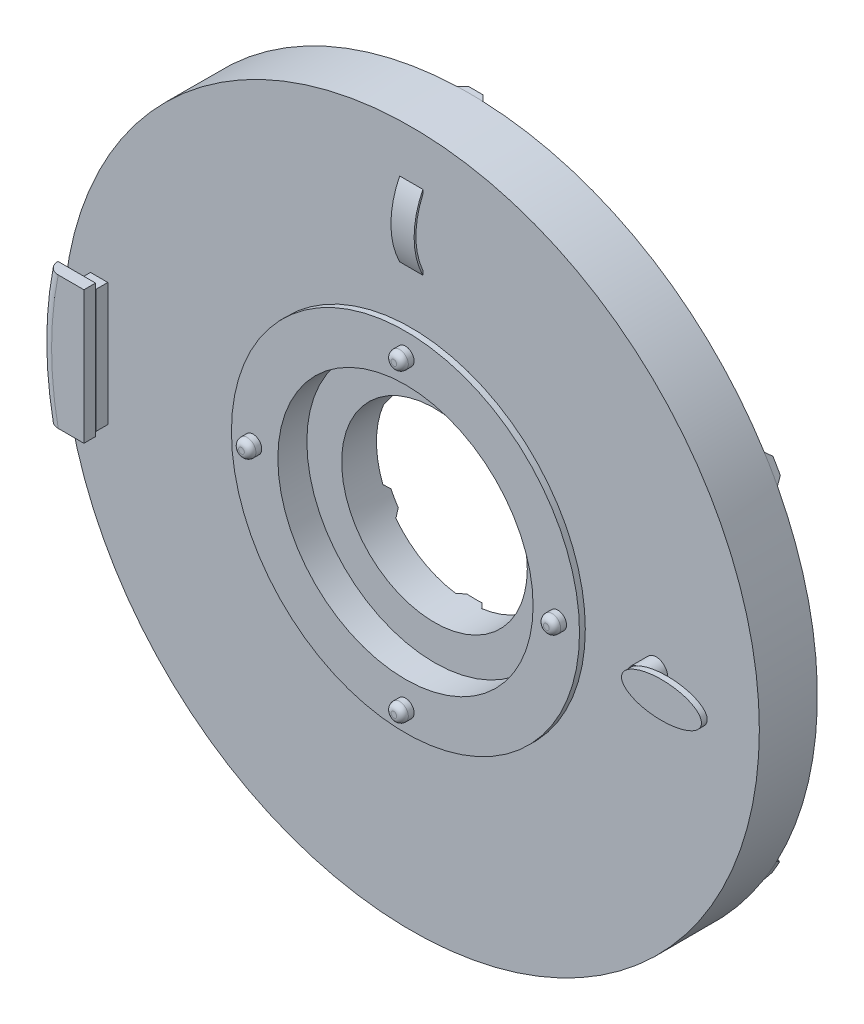
from build123d import *

# Parameters (mm, degrees)
SKETCH1_R                    = 600
BOSS_EXTRUDE1_DEPTH          = 100
SKETCH2_R                    = 300
BOSS_EXTRUDE2_DEPTH          = 10
SKETCH3_R                    = 220
CUT_EXTRUDE1_DEPTH           = 50
SKETCH4_R                    = 160
CUT_EXTRUDE2_DEPTH           = 851.646812725
SKETCH6_R                    = 14.913025091
BOSS_EXTRUDE4_DEPTH          = 20
FILLET1_R                    = 10
SKETCH7_W                    = 29.826050183
SKETCH7_H                    = 212.223818606
BOSS_EXTRUDE5_DEPTH          = 20
BOSS_EXTRUDE6_DEPTH          = 20
FILLET2_R                    = 20
SKETCH10_R                   = 19.778043507
BOSS_EXTRUDE7_DEPTH          = 30
SKETCH11_RX                  = 68.900732716
SKETCH11_RY                  = 30.614806754
BOSS_EXTRUDE9_DEPTH          = 10
BOSS_EXTRUDE10_DEPTH         = 20
BOSS_EXTRUDE11_DEPTH         = 10
CHAMFER1_SIZE                = 9.0254
CIRPATTERN1_COUNT            = 6
CHAMFER1_OF_CIRPATTERN1_SIZE = 9.0254
SKETCH14_R                   = 17.44469043
BOSS_EXTRUDE12_DEPTH         = 10
FILLET3_R                    = 8


with BuildPart() as part:
    # Sketch1 → Boss-Extrude1 (new body)
    with BuildSketch(Plane.XY):
        Circle(SKETCH1_R)
    extrude(amount=BOSS_EXTRUDE1_DEPTH)

    # Sketch2 → Boss-Extrude2 (add)
    with BuildSketch(Plane.XY.offset(100)):
        Circle(SKETCH2_R)
    extrude(amount=BOSS_EXTRUDE2_DEPTH)

    # Sketch3 → Cut-Extrude1 (cut)
    with BuildSketch(Plane.XY.offset(110)):
        Circle(SKETCH3_R)
    extrude(amount=-CUT_EXTRUDE1_DEPTH, mode=Mode.SUBTRACT)

    # Sketch4 → Cut-Extrude2 (cut, through all)
    with BuildSketch(Plane.XY.offset(60)):
        Circle(SKETCH4_R)
    extrude(amount=-CUT_EXTRUDE2_DEPTH, mode=Mode.SUBTRACT)

    # Sketch6 → Boss-Extrude4 (add)
    with BuildSketch(Plane.XY.offset(110)):
        with Locations((-262.698672761, 0)):
            Circle(SKETCH6_R)
        with Locations((0, 262.698672761)):
            Circle(SKETCH6_R)
        with Locations((262.698672761, 0)):
            Circle(SKETCH6_R)
        with Locations((0, -262.698672761)):
            Circle(SKETCH6_R)
    extrude(amount=BOSS_EXTRUDE4_DEPTH)

    # Fillet1
    fillet1_edges = [part.edges().sort_by_distance(p)[0] for p in [
        (-277.611697852, 0, 130),
        (-14.913025091, 262.698672761, 130),
        (247.78564767, 0, 130),
        (-14.913025091, -262.698672761, 130),
    ]]
    fillet(fillet1_edges, radius=FILLET1_R)

    # Sketch7 → Boss-Extrude5 (add)
    with BuildSketch(Plane.XY.offset(100)):
        with Locations((-538.016059061, 0)):
            Rectangle(SKETCH7_W, SKETCH7_H)
    extrude(amount=BOSS_EXTRUDE5_DEPTH)

    # Sketch9 → Boss-Extrude6 (add)
    with BuildSketch(Plane.XY.offset(120)):
        with BuildLine():
            Line((-588.949449766, 114.623495062), (-524.250189746, 114.623495062))
            Line((-524.250189746, 114.623495062), (-524.250189746, -114.623495062))
            Line((-524.250189746, -114.623495062), (-588.949449766, -114.623495062))
            ThreePointArc((-588.949449766, -114.623495062), (-600, 0), (-588.949449766, 114.623495062))
        make_face()
    extrude(amount=BOSS_EXTRUDE6_DEPTH)

    # Fillet2
    fillet2_edges = [part.edges().sort_by_distance(p)[0] for p in [
        (-600, 0, 140),
    ]]
    fillet(fillet2_edges, radius=FILLET2_R - 0.0001)  # a hair under: the kernel refuses the full size

    # Sketch10 → Boss-Extrude7 (add)
    with BuildSketch(Plane.XY.offset(100)):
        with Locations((422.153325659, 0)):
            Circle(SKETCH10_R)
    extrude(amount=BOSS_EXTRUDE7_DEPTH)

    # Sketch11 → Boss-Extrude9 (add)
    with BuildSketch(Plane.XY.offset(130)):
        with Locations(Location((471.276014868, 0), (0, 0, 180))):
            Ellipse(SKETCH11_RX, SKETCH11_RY)
    extrude(amount=BOSS_EXTRUDE9_DEPTH)

    # Sketch12 → Boss-Extrude10 (add)
    with BuildSketch(Plane(origin=(0, 0, 0), x_dir=(0, 0, -1), z_dir=(1, 0, 0))):
        with BuildLine():
            Line((-100, 509.437716403), (-100, 516.609901971))
            ThreePointArc((-100, 516.609901971), (-115.08720969, 452.50849346), (-100, 388.407084949))
            Line((-100, 388.407084949), (-100, 395.579270517))
            ThreePointArc((-100, 395.579270517), (-112.034809058, 452.50849346), (-100, 509.437716403))
        make_face()
    boss_extrude10 = extrude(amount=BOSS_EXTRUDE10_DEPTH)

    # Mirror1: Boss-Extrude10 across plane
    add(boss_extrude10.mirror(Plane(origin=(0, 0, 0), x_dir=(0, 0, 1), z_dir=(1, 0, 0))))

    # Sketch13 → Boss-Extrude11 (add)
    with BuildSketch(Plane(origin=(0, 0, 0), x_dir=(-1, 0, 0), z_dir=(0, 0, -1))):
        with BuildLine():
            Line((20.620804021, 158.66563094), (20.620804021, 599.645547337))
            Line((20.620804021, 599.645547337), (-22.867499746, 599.564072852))
            Line((-22.867499746, 599.564072852), (-22.867499746, 158.357435744))
            ThreePointArc((-22.867499746, 158.357435744), (-1.133867933, 159.995982273), (20.620804021, 158.66563094))
        make_face()
    boss_extrude11 = extrude(amount=BOSS_EXTRUDE11_DEPTH)

    # Chamfer1
    chamfer1_edges = [part.edges().sort_by_distance(p)[0] for p in [
        (-20.620804021, 379.155589139, -10),
        (22.867499746, 378.960754298, -10),
    ]]
    chamfer(chamfer1_edges, length=CHAMFER1_SIZE)

    # CirPattern1: Boss-Extrude11 ×6 about axis
    cirpattern1_axis = Axis((0, 0, 0), (0, 0, 1))
    for i in range(1, CIRPATTERN1_COUNT):
        add(boss_extrude11.rotate(cirpattern1_axis, i * 360 / CIRPATTERN1_COUNT))

    # Chamfer1 of CirPattern1
    chamfer1_of_cirpattern1_edges = [part.edges().sort_by_distance(p)[0] for p in [
        (-338.668774191, 171.719654441, -10),
        (-316.755890386, 209.28421285, -10),
        (-318.04797017, -207.435934698, -10),
        (-339.623390133, -169.676541448, -10),
        (20.620804021, -379.155589139, -10),
        (-22.867499746, -378.960754298, -10),
        (338.668774191, -171.719654441, -10),
        (316.755890386, -209.28421285, -10),
        (318.04797017, 207.435934698, -10),
        (339.623390133, 169.676541448, -10),
    ]]
    chamfer(chamfer1_of_cirpattern1_edges, length=CHAMFER1_OF_CIRPATTERN1_SIZE)

    # Sketch14 → Boss-Extrude12 (add)
    with BuildSketch(Plane(origin=(0, 0, 0), x_dir=(-1, 0, 0), z_dir=(0, 0, -1))):
        with Locations(Location((-195.016481962, 0, 0), (0, 0, 180))):
            Circle(SKETCH14_R)
        with Locations(Location((-97.508240981, 168.889227536, 0), (0, 0, 180))):
            Circle(SKETCH14_R)
        with Locations(Location((97.508240981, 168.889227536, 0), (0, 0, 180))):
            Circle(SKETCH14_R)
        with Locations(Location((195.016481962, 0, 0), (0, 0, 180))):
            Circle(SKETCH14_R)
        with Locations(Location((97.508240981, -168.889227536, 0), (0, 0, 180))):
            Circle(SKETCH14_R)
        with Locations(Location((-97.508240981, -168.889227536, 0), (0, 0, 180))):
            Circle(SKETCH14_R)
    extrude(amount=BOSS_EXTRUDE12_DEPTH)

    # Fillet3
    fillet3_edges = [part.edges().sort_by_distance(p)[0] for p in [
        (177.571791532, 0, -10),
        (80.063550551, 168.889227536, -10),
        (-114.952931412, 168.889227536, -10),
        (-212.461172393, 0, -10),
        (-114.952931412, -168.889227536, -10),
        (80.063550551, -168.889227536, -10),
    ]]
    fillet(fillet3_edges, radius=FILLET3_R)


solid = part.part
